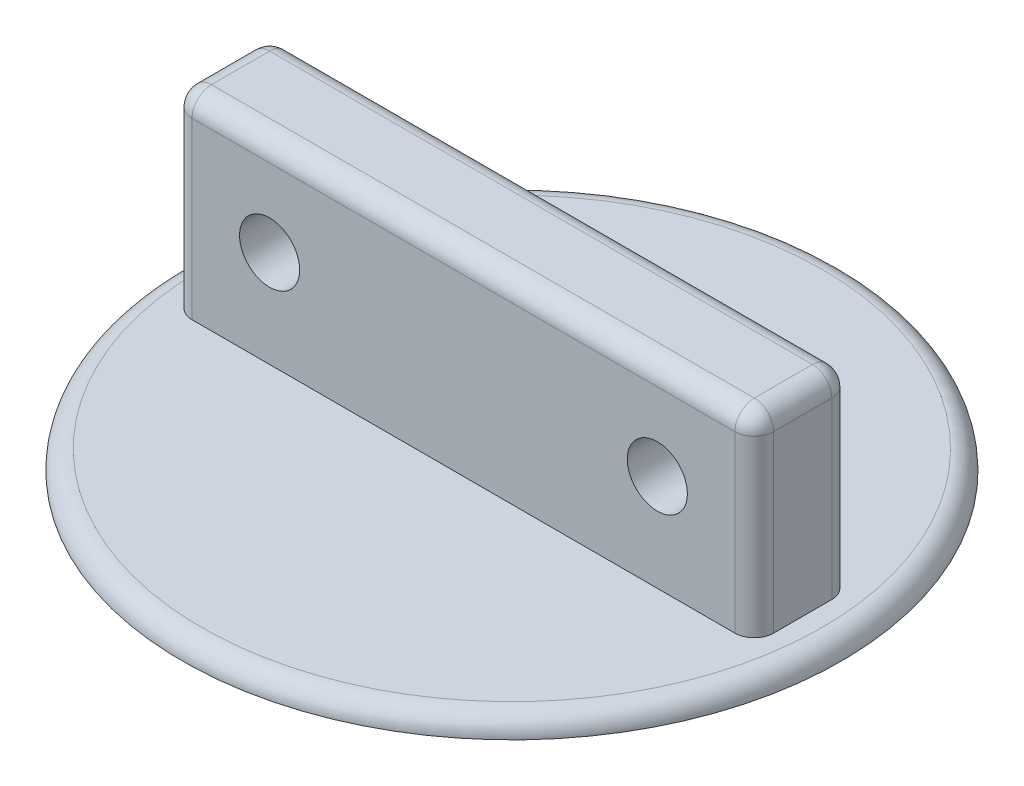
from build123d import *

# Parameters (mm, degrees)
SKETCH1_W                      = 76.2
SKETCH1_H                      = 25.4
BOSS_EXTRUDE1_DEPTH            = 6.35
FILLET1_R                      = 2.54
F_97_0_31_DIAMETER_HOLE1_D     = 7.874
F_97_0_31_DIAMETER_HOLE1_DEPTH = 25.4
F_97_0_31_DIAMETER_HOLE1_TIP   = 2.365588257
SKETCH4_R                      = 43.18
BOSS_EXTRUDE2_DEPTH            = 2.54
FILLET2_R                      = 2.54


with BuildPart() as part:
    # Sketch1 → Boss-Extrude1 (new, symmetric)
    with BuildSketch(Plane.XY):
        Rectangle(SKETCH1_W, SKETCH1_H)
    extrude(amount=BOSS_EXTRUDE1_DEPTH, both=True)

    # Fillet1
    fillet1_edges = [part.edges().sort_by_distance(p)[0] for p in [
        (-38.1, 0, 6.35),
        (38.1, 0, 6.35),
        (-38.1, 0, -6.35),
        (0, 12.7, -6.35),
        (38.1, 0, -6.35),
        (-38.1, 12.7, 0),
        (38.1, 12.7, 0),
        (0, 12.7, 6.35),
    ]]
    fillet(fillet1_edges, radius=FILLET1_R)

    # #97 (0.31) Diameter Hole1
    with Locations(Plane.XY.offset(6.35)):
        with Locations((25.4, 0), (-25.4, 0)):
            Hole(F_97_0_31_DIAMETER_HOLE1_D / 2, depth=F_97_0_31_DIAMETER_HOLE1_DEPTH)
            with Locations((0, 0, -(F_97_0_31_DIAMETER_HOLE1_DEPTH + F_97_0_31_DIAMETER_HOLE1_TIP / 2))):  # 118° drill point
                Cone(0, F_97_0_31_DIAMETER_HOLE1_D / 2, F_97_0_31_DIAMETER_HOLE1_TIP, mode=Mode.SUBTRACT)

    # Sketch4 → Boss-Extrude2 (add)
    with BuildSketch(Plane.XZ.offset(12.7)):
        with Locations(Location((0, 0, 0), (0, 0, 270))):
            Circle(SKETCH4_R)
    extrude(amount=BOSS_EXTRUDE2_DEPTH)

    # Fillet2
    fillet2_edges = [part.edges().sort_by_distance(p)[0] for p in [
        (0, -12.7, 43.18),
    ]]
    fillet(fillet2_edges, radius=FILLET2_R - 0.0001)  # a hair under: the kernel refuses the full size


solid = part.part
